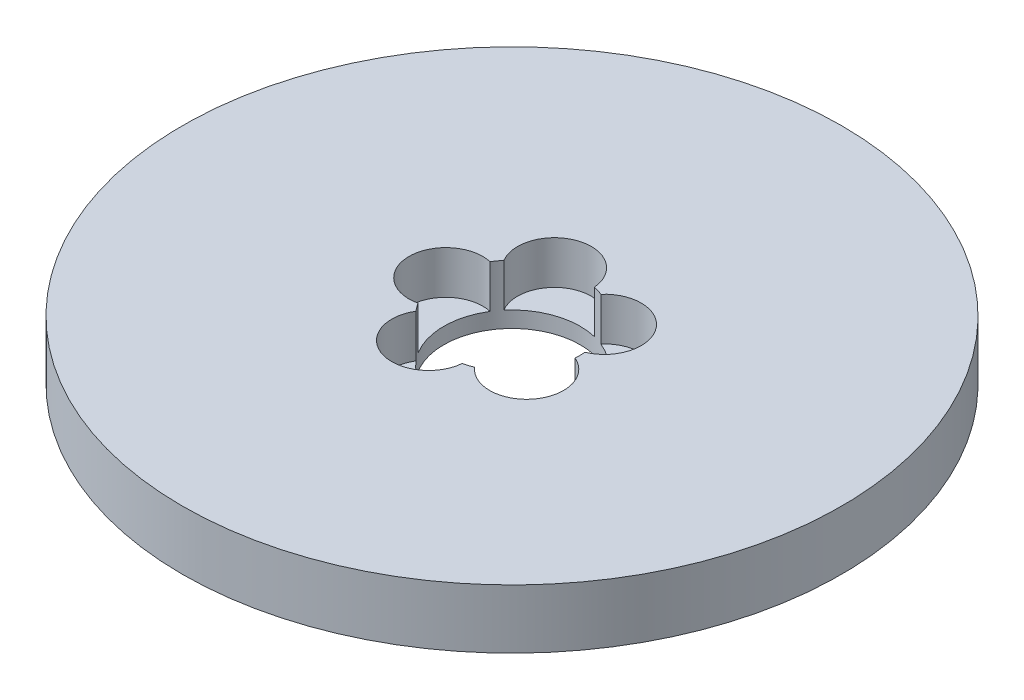
from build123d import *

# Parameters (mm, degrees)
SKETCH1_R           = 72.5
BOSS_EXTRUDE1_DEPTH = 13
SKETCH2_R           = 15
CUT_EXTRUDE1_DEPTH  = 104.351342517
SKETCH3_R           = 8.118490389
CUT_EXTRUDE2_DEPTH  = 9.4740348
CIRPATTERN1_COUNT   = 5


with BuildPart() as part:
    # Sketch1 → Boss-Extrude1 (new body)
    with BuildSketch(Plane(origin=(0, 0, 0), x_dir=(1, 0, 0), z_dir=(0, 1, 0))):
        Circle(SKETCH1_R)
    extrude(amount=BOSS_EXTRUDE1_DEPTH)

    # Sketch2 → Cut-Extrude1 (cut, through all)
    with BuildSketch(Plane(origin=(0, 0, 0), x_dir=(1, 0, 0), z_dir=(0, 1, 0))):
        Circle(SKETCH2_R)
    extrude(amount=CUT_EXTRUDE1_DEPTH, mode=Mode.SUBTRACT)

    # Sketch3 → Cut-Extrude2 (cut)
    with BuildSketch(Plane(origin=(0, 13, 0), x_dir=(1, 0, 0), z_dir=(0, 1, 0))):
        with Locations((-14.545147053, 0)):
            Circle(SKETCH3_R)
    cut_extrude2 = extrude(amount=-CUT_EXTRUDE2_DEPTH, mode=Mode.SUBTRACT)

    # CirPattern1: Cut-Extrude2 ×5 about axis
    cirpattern1_axis = Axis((0, 0, 0), (0, 1, 0))
    for i in range(1, CIRPATTERN1_COUNT):
        add(cut_extrude2.rotate(cirpattern1_axis, i * 360 / CIRPATTERN1_COUNT), mode=Mode.SUBTRACT)


solid = part.part
